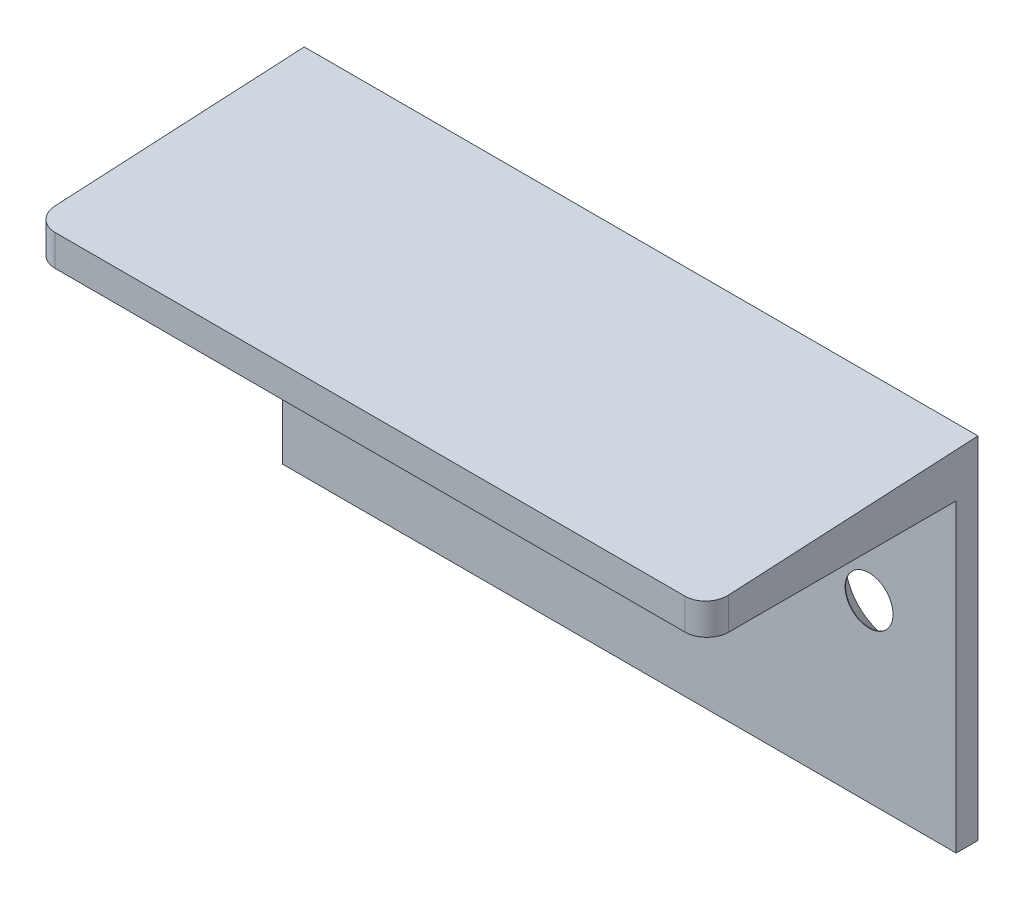
from build123d import *

# Parameters (mm, degrees)
SKETCH1_W                                       = 77.3
SKETCH1_H                                       = 40.2
BOSS_EXTRUDE1_DEPTH                             = 2.5
SKETCH3_W                                       = 77.3
SKETCH3_H                                       = 5.2
BOSS_EXTRUDE2_DEPTH                             = 28.599
FILLET1_R                                       = 2.5
SKETCH4_W                                       = 77.3
SKETCH4_H                                       = 37.342788029
CUT_REVOLVE2_ANGLE                              = 3
CSK_FOR_M5_FLAT_HEAD_MACHINE_SCREW1_D           = 5.5
CSK_FOR_M5_FLAT_HEAD_MACHINE_SCREW1_DEPTH       = 12.4
CSK_FOR_M5_FLAT_HEAD_MACHINE_SCREW1_CSINK_D     = 10.4
CSK_FOR_M5_FLAT_HEAD_MACHINE_SCREW1_CSINK_ANGLE = 90
CSK_FOR_M5_FLAT_HEAD_MACHINE_SCREW1_TIP         = 1.652366702


with BuildPart() as part:
    # Sketch1 → Boss-Extrude1 (new body)
    with BuildSketch(Plane.XY):
        Rectangle(SKETCH1_W, SKETCH1_H)
    extrude(amount=BOSS_EXTRUDE1_DEPTH)

    # Sketch3 → Boss-Extrude2 (add)
    with BuildSketch(Plane.XY.offset(2.5)):
        with Locations((0, 17.5)):
            Rectangle(SKETCH3_W, SKETCH3_H)
    extrude(amount=BOSS_EXTRUDE2_DEPTH)

    # Fillet1
    fillet1_edges = [part.edges().sort_by_distance(p)[0] for p in [
        (-38.65, 17.5, 31.099),
        (38.65, 17.5, 31.099),
    ]]
    fillet(fillet1_edges, radius=FILLET1_R)

    # Sketch4 → Cut-Revolve2 (revolve, cut)
    with BuildSketch(Plane(origin=(0, 20.1, 0), x_dir=(1, 0, 0), z_dir=(0, 1, 0))):
        with Locations((0, -18.671394015)):
            Rectangle(SKETCH4_W, SKETCH4_H)
    revolve(axis=Axis((-38.65, 20.1, 0), (1, 0, 0)), revolution_arc=CUT_REVOLVE2_ANGLE, mode=Mode.SUBTRACT)

    # CSK for M5 Flat Head Machine Screw1
    with Locations(Plane(origin=(0, 0, 0), x_dir=(-1, 0, 0), z_dir=(0, 0, -1))):
        with Locations((-28.65, 0), (28.65, 0)):
            CounterSinkHole(CSK_FOR_M5_FLAT_HEAD_MACHINE_SCREW1_D / 2, CSK_FOR_M5_FLAT_HEAD_MACHINE_SCREW1_CSINK_D / 2, depth=CSK_FOR_M5_FLAT_HEAD_MACHINE_SCREW1_DEPTH, counter_sink_angle=CSK_FOR_M5_FLAT_HEAD_MACHINE_SCREW1_CSINK_ANGLE)
            with Locations((0, 0, -(CSK_FOR_M5_FLAT_HEAD_MACHINE_SCREW1_DEPTH + CSK_FOR_M5_FLAT_HEAD_MACHINE_SCREW1_TIP / 2))):  # 118° drill point
                Cone(0, CSK_FOR_M5_FLAT_HEAD_MACHINE_SCREW1_D / 2, CSK_FOR_M5_FLAT_HEAD_MACHINE_SCREW1_TIP, mode=Mode.SUBTRACT)


solid = part.part
